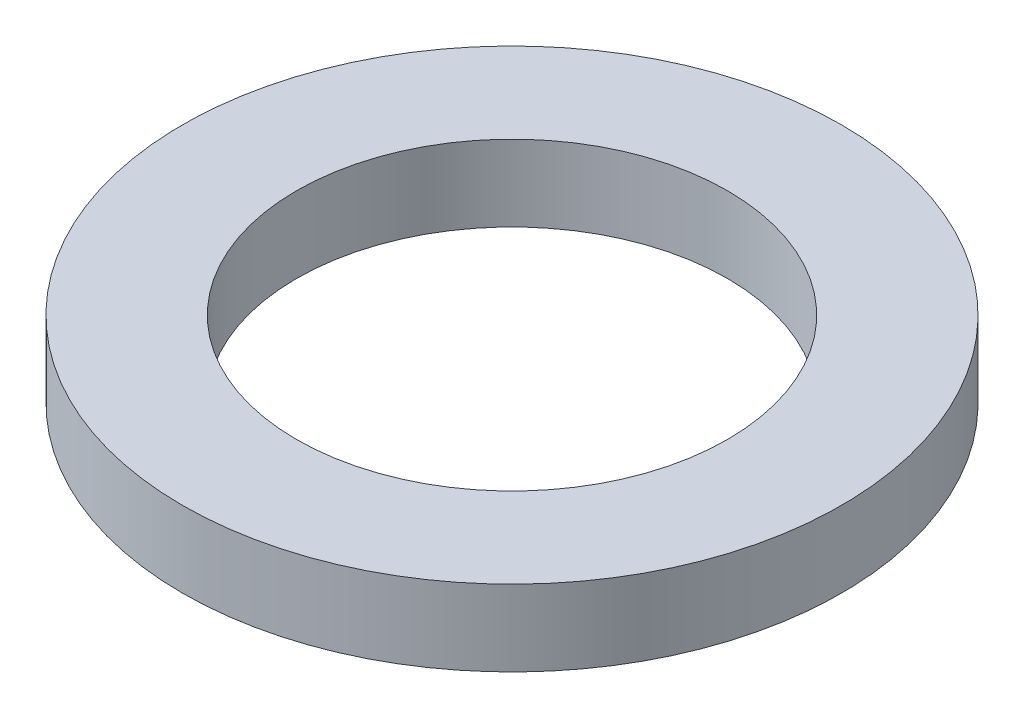
from build123d import *

# Parameters (mm, degrees)
SKETCH1_R           = 65
BOSS_EXTRUDE1_DEPTH = 15
SKETCH2_R           = 42.5
CUT_EXTRUDE1_DEPTH  = 94.139680051


with BuildPart() as part:
    # Sketch1 → Boss-Extrude1 (new body)
    with BuildSketch(Plane(origin=(0, 0, 0), x_dir=(1, 0, 0), z_dir=(0, 1, 0))):
        Circle(SKETCH1_R)
    extrude(amount=BOSS_EXTRUDE1_DEPTH)

    # Sketch2 → Cut-Extrude1 (cut, through all)
    with BuildSketch(Plane(origin=(0, 0, 0), x_dir=(1, 0, 0), z_dir=(0, 1, 0))):
        Circle(SKETCH2_R)
    extrude(amount=CUT_EXTRUDE1_DEPTH, mode=Mode.SUBTRACT)


solid = part.part
